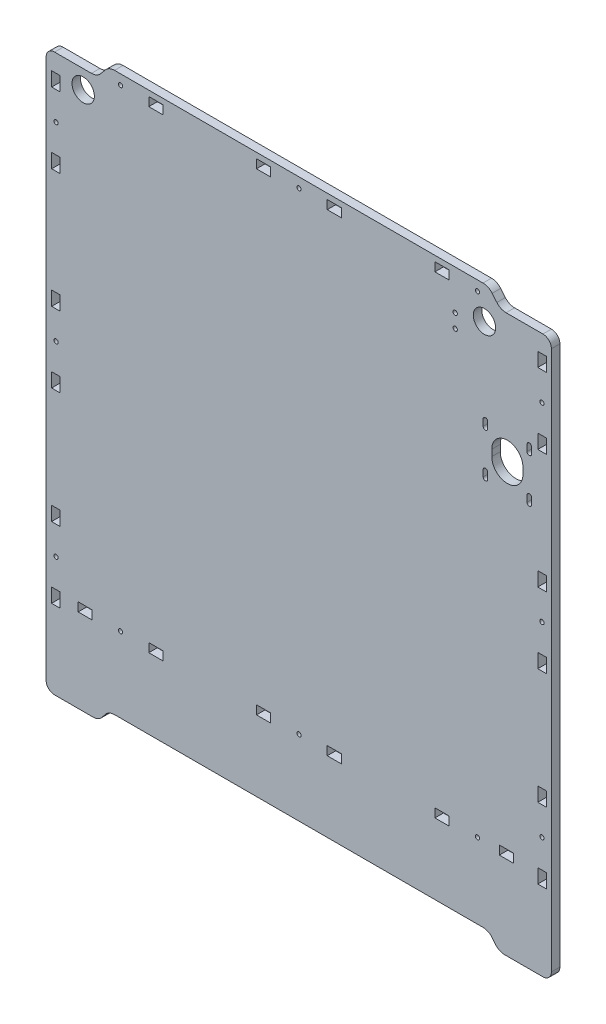
from build123d import *

# Parameters (mm, degrees)
SKETCH_1_R      = 1.55
SKETCH_1_R_2    = 7.9
SKETCH_1_R_3    = 1.5
SKETCH_1_W      = 5.906395822
SKETCH_1_H      = 10
SKETCH_1_W_2    = 9.994814166
SKETCH_1_H_2    = 6.199822499
SKETCH_1_W_3    = 9.849167249
SKETCH_1_W_4    = 9.971716679
SKETCH_1_H_3    = 6.19978722
SKETCH_1_W_5    = 9.976438663
SKETCH_1_W_6    = 9.849167498
SKETCH_1_W_7    = 9.949996322
SKETCH_1_W_8    = 9.96963529
SKETCH_1_H_4    = 6.199787221
SKETCH_1_W_9    = 9.974357274
SKETCH_1_W_10   = 6
SKETCH_1_W_11   = 6.021531284
SKETCH_1_W_12   = 6.011865173
SKETCH_1_W_13   = 9.973103266
EXTRUDE_1_DEPTH = 6


with BuildPart() as part:
    # Эскиз1 → Бобышка-Вытянуть1 (new body)
    with BuildSketch(Plane.XY):
        with BuildLine():
            Line((146.640626228, 192.019388015), (172.677011134, 192.019388015))
            ThreePointArc((172.677011134, 192.019388015), (176.919651821, 190.262028702), (178.677011134, 186.019388015))
            Line((178.677011134, 186.019388015), (178.677011134, -195.291239761))
            ThreePointArc((178.677011134, -195.291239761), (176.919651821, -199.533880448), (172.677011134, -201.291239761))
            Line((172.677011134, -201.291239761), (145.640626228, -201.291239761))
            ThreePointArc((145.640626228, -201.291239761), (142.048371003, -200.494855951), (139.129248462, -198.254934444))
            Line((139.129248462, -198.254934444), (136.833422409, -195.235281348))
            ThreePointArc((136.833422409, -195.235281348), (133.914299867, -192.995359841), (130.322044642, -192.198976031))
            Line((130.322044642, -192.198976031), (-129.968022375, -192.198976031))
            ThreePointArc((-129.968022375, -192.198976031), (-133.560277599, -192.995359841), (-136.479400141, -195.235281348))
            Line((-136.479400141, -195.235281348), (-138.775226194, -198.254934444))
            ThreePointArc((-138.775226194, -198.254934444), (-141.694348736, -200.494855951), (-145.286603961, -201.291239761))
            Line((-145.286603961, -201.291239761), (-172.322988866, -201.291239761))
            ThreePointArc((-172.322988866, -201.291239761), (-176.565629553, -199.533880448), (-178.322988866, -195.291239761))
            Line((-178.322988866, -195.291239761), (-178.322988866, 186.019388015))
            ThreePointArc((-178.322988866, 186.019388015), (-176.565629553, 190.262028702), (-172.322988866, 192.019388015))
            Line((-172.322988866, 192.019388015), (-146.286603961, 192.019388015))
            ThreePointArc((-146.286603961, 192.019388015), (-142.694348736, 192.815771826), (-139.775226194, 195.055693333))
            Line((-139.775226194, 195.055693333), (-136.479400141, 198.983505872))
            ThreePointArc((-136.479400141, 198.983505872), (-133.560277599, 201.22342738), (-129.968022375, 202.01981119))
            Line((-129.968022375, 202.01981119), (130.322044642, 202.01981119))
            ThreePointArc((130.322044642, 202.01981119), (133.914299867, 201.22342738), (136.833422409, 198.983505872))
            Line((136.833422409, 198.983505872), (140.129248462, 195.055693333))
            ThreePointArc((140.129248462, 195.055693333), (143.048371003, 192.815771826), (146.640626228, 192.019388015))
        make_face()
        with Locations((110.677011134, 164.31981119)):
            Circle(SKETCH_1_R, mode=Mode.SUBTRACT)
        with Locations((110.677011134, 174.01981119)):
            Circle(SKETCH_1_R, mode=Mode.SUBTRACT)
        with Locations((131.377011134, 179.01981119)):
            Circle(SKETCH_1_R_2, mode=Mode.SUBTRACT)
        with Locations((-152.122988866, 179.01981119)):
            Circle(SKETCH_1_R_2, mode=Mode.SUBTRACT)
        with Locations((-171.241452606, 149.64695507)):
            Circle(SKETCH_1_R_3, mode=Mode.SUBTRACT)
        with Locations((-171.241452606, 15.573514819)):
            Circle(SKETCH_1_R_3, mode=Mode.SUBTRACT)
        with Locations((171.987715265, 149.67420525)):
            Circle(SKETCH_1_R_3, mode=Mode.SUBTRACT)
        with Locations((126.462093852, 195.057081698)):
            Circle(SKETCH_1_R_3, mode=Mode.SUBTRACT)
        with Locations((-125.710663701, 195.057081698)):
            Circle(SKETCH_1_R_3, mode=Mode.SUBTRACT)
        with Locations((0.358090643, 195.057081698)):
            Circle(SKETCH_1_R_3, mode=Mode.SUBTRACT)
        with Locations((-125.74954067, -139.065910363)):
            Circle(SKETCH_1_R_3, mode=Mode.SUBTRACT)
        with Locations((-171.241452606, -116.21234228)):
            Circle(SKETCH_1_R_3, mode=Mode.SUBTRACT)
        with Locations((0.375695716, -139.065910363)):
            Circle(SKETCH_1_R_3, mode=Mode.SUBTRACT)
        with Locations((126.442808867, -139.065910363)):
            Circle(SKETCH_1_R_3, mode=Mode.SUBTRACT)
        with Locations((171.987715265, -116.21234228)):
            Circle(SKETCH_1_R_3, mode=Mode.SUBTRACT)
        with Locations((171.987715265, 15.509293857)):
            Circle(SKETCH_1_R_3, mode=Mode.SUBTRACT)
        with BuildLine():
            Line((133.65547985, 83.46981119), (133.65547985, 87.96981119))
            ThreePointArc((133.65547985, 87.96981119), (132.05547985, 89.56981119), (130.45547985, 87.96981119))
            Line((130.45547985, 87.96981119), (130.45547985, 83.46981119))
            ThreePointArc((130.45547985, 83.46981119), (132.05547985, 81.86981119), (133.65547985, 83.46981119))
        make_face(mode=Mode.SUBTRACT)
        with BuildLine():
            Line((133.65547985, 118.96981119), (133.65547985, 114.46981119))
            ThreePointArc((133.65547985, 114.46981119), (132.05547985, 112.86981119), (130.45547985, 114.46981119))
            Line((130.45547985, 114.46981119), (130.45547985, 118.96981119))
            ThreePointArc((130.45547985, 118.96981119), (132.05547985, 120.56981119), (133.65547985, 118.96981119))
        make_face(mode=Mode.SUBTRACT)
        with BuildLine():
            Line((158.55547985, 98.96981119), (158.55547985, 103.46981119))
            ThreePointArc((158.55547985, 103.46981119), (147.55547985, 114.46981119), (136.55547985, 103.46981119))
            Line((136.55547985, 103.46981119), (136.55547985, 98.96981119))
            ThreePointArc((136.55547985, 98.96981119), (147.55547985, 87.96981119), (158.55547985, 98.96981119))
        make_face(mode=Mode.SUBTRACT)
        with BuildLine():
            Line((161.45547985, 118.96981119), (161.45547985, 114.46981119))
            ThreePointArc((161.45547985, 114.46981119), (163.05547985, 112.86981119), (164.65547985, 114.46981119))
            Line((164.65547985, 114.46981119), (164.65547985, 118.96981119))
            ThreePointArc((164.65547985, 118.96981119), (163.05547985, 120.56981119), (161.45547985, 118.96981119))
        make_face(mode=Mode.SUBTRACT)
        with BuildLine():
            Line((161.45547985, 83.46981119), (161.45547985, 87.96981119))
            ThreePointArc((161.45547985, 87.96981119), (163.05547985, 89.56981119), (164.65547985, 87.96981119))
            Line((164.65547985, 87.96981119), (164.65547985, 83.46981119))
            ThreePointArc((164.65547985, 83.46981119), (163.05547985, 81.86981119), (161.45547985, 83.46981119))
        make_face(mode=Mode.SUBTRACT)
        with Locations((-171.391875868, 40.421614562)):
            Rectangle(SKETCH_1_W, SKETCH_1_H, mode=Mode.SUBTRACT)
        with Locations((101.375242683, -139.100475893)):
            Rectangle(SKETCH_1_W_2, SKETCH_1_H_2, mode=Mode.SUBTRACT)
        with Locations((146.834619429, -139.100475893)):
            Rectangle(SKETCH_1_W_3, SKETCH_1_H_2, mode=Mode.SUBTRACT)
        with Locations((-24.705755079, 195.005248414)):
            Rectangle(SKETCH_1_W_4, SKETCH_1_H_3, mode=Mode.SUBTRACT)
        with Locations((25.291923766, 195.005248414)):
            Rectangle(SKETCH_1_W_5, SKETCH_1_H_3, mode=Mode.SUBTRACT)
        with Locations((-150.741012535, -139.100475893)):
            Rectangle(SKETCH_1_W_6, SKETCH_1_H_2, mode=Mode.SUBTRACT)
        with Locations((-100.791387959, -139.100475893)):
            Rectangle(SKETCH_1_W_7, SKETCH_1_H_2, mode=Mode.SUBTRACT)
        with Locations((-24.706795773, -139.09908242)):
            Rectangle(SKETCH_1_W_8, SKETCH_1_H_4, mode=Mode.SUBTRACT)
        with Locations((25.290883071, -139.09908242)):
            Rectangle(SKETCH_1_W_9, SKETCH_1_H_4, mode=Mode.SUBTRACT)
        with Locations((-171.438677957, -9.578426536)):
            Rectangle(SKETCH_1_W_10, SKETCH_1_H, mode=Mode.SUBTRACT)
        with Locations((-171.391875868, 174.593092862)):
            Rectangle(SKETCH_1_W, SKETCH_1_H, mode=Mode.SUBTRACT)
        with Locations((-171.391875868, 124.593228152)):
            Rectangle(SKETCH_1_W, SKETCH_1_H, mode=Mode.SUBTRACT)
        with Locations((-171.438677957, -91.299573267)):
            Rectangle(SKETCH_1_W_10, SKETCH_1_H, mode=Mode.SUBTRACT)
        with Locations((-171.438677957, -141.299614366)):
            Rectangle(SKETCH_1_W_10, SKETCH_1_H, mode=Mode.SUBTRACT)
        with Locations((172.066245492, 40.421614562)):
            Rectangle(SKETCH_1_W_11, SKETCH_1_H, mode=Mode.SUBTRACT)
        with Locations((172.066245492, -9.578426536)):
            Rectangle(SKETCH_1_W_11, SKETCH_1_H, mode=Mode.SUBTRACT)
        with Locations((172.066245492, -91.299573267)):
            Rectangle(SKETCH_1_W_11, SKETCH_1_H, mode=Mode.SUBTRACT)
        with Locations((172.066245492, -141.299614366)):
            Rectangle(SKETCH_1_W_11, SKETCH_1_H, mode=Mode.SUBTRACT)
        Polygon((169.05547985, 169.743748976), (169.05547985, 179.593092862), (175.067345023, 179.593092862), (175.077011134, 169.81981119), (175.067345023, 169.743748976), align=None, mode=Mode.SUBTRACT)
        with Locations((172.061412437, 124.593228152)):
            Rectangle(SKETCH_1_W_12, SKETCH_1_H, mode=Mode.SUBTRACT)
        with Locations((-100.779834487, 195.002849525)):
            Rectangle(SKETCH_1_W_13, SKETCH_1_H_3, mode=Mode.SUBTRACT)
        Polygon((106.3778356, 191.902955915), (106.177011134, 191.91981119), (96.3778356, 191.902955915), (96.3778356, 198.102743135), (106.177011134, 198.11981119), (106.3778356, 198.102743135), align=None, mode=Mode.SUBTRACT)
    extrude(amount=EXTRUDE_1_DEPTH)


solid = part.part
